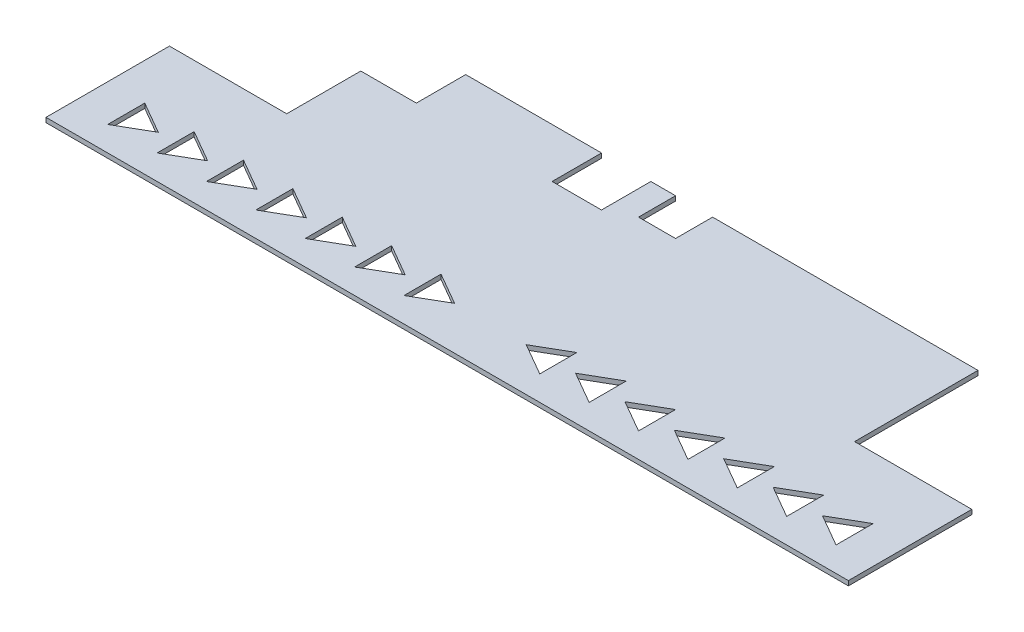
from build123d import *

# Parameters (mm, degrees)
SKETCH1_W          = 825.5
SKETCH1_H          = 254
BASE_FLANGE1_DEPTH = 4.7625
SKETCH6_W          = 38.1
SKETCH6_H          = 76.2
SKETCH6_W_2        = 241.3
SKETCH6_H_2        = 101.6
SKETCH6_W_3        = 50.8
CUT_EXTRUDE1_DEPTH = 432.872948801
SKETCH7_W          = 177.8
SKETCH7_H          = 50.8
SKETCH7_W_2        = 120.65
SKETCH7_H_2        = 25.4
CUT_EXTRUDE2_DEPTH = 432.872948801
CUT_EXTRUDE3_DEPTH = 432.872948801


# Sheet-metal steps are written as plain solids
with BuildPart() as part:
    # Sketch1 → Base-Flange1 (new body)
    with BuildSketch(Plane(origin=(0, 0, 0), x_dir=(1, 0, 0), z_dir=(0, 1, 0))):
        Rectangle(SKETCH1_W, SKETCH1_H)
    extrude(amount=-BASE_FLANGE1_DEPTH)

    # Sketch6 → Cut-Extrude1 (cut, through all)
    with BuildSketch(Plane(origin=(0, 0, 0), x_dir=(1, 0, 0), z_dir=(0, 1, 0))):
        with Locations((0, 127)):
            Rectangle(SKETCH6_W, SKETCH6_H)
        with Locations((-412.75, 50.8)):
            Rectangle(SKETCH6_W_2, SKETCH6_H_2)
        with Locations((412.75, 50.8)):
            Rectangle(SKETCH6_W_2, SKETCH6_H_2)
        with Locations((-69.85, 127)):
            Rectangle(SKETCH6_W_3, SKETCH6_H_2)
    extrude(amount=-CUT_EXTRUDE1_DEPTH, mode=Mode.SUBTRACT)

    # Sketch7 → Cut-Extrude2 (cut, through all)
    with BuildSketch(Plane(origin=(0, 0, 0), x_dir=(1, 0, 0), z_dir=(0, 1, 0))):
        with Locations((-323.85, 101.6)):
            Rectangle(SKETCH7_W, SKETCH7_H)
        with Locations((352.425, 114.3)):
            Rectangle(SKETCH7_W_2, SKETCH7_H_2)
    extrude(amount=-CUT_EXTRUDE2_DEPTH, mode=Mode.SUBTRACT)

    # Sketch8 → Cut-Extrude3 (cut, through all)
    with BuildSketch(Plane(origin=(0, 0, 0), x_dir=(1, 0, 0), z_dir=(0, 1, 0))):
        Polygon((341.654432116, -82.55), (374.65, -101.6), (374.65, -63.5), align=None)
        Polygon((323.85, -101.6), (323.85, -63.5), (290.854432116, -82.55), align=None)
        Polygon((273.05, -101.6), (273.05, -63.5), (240.054432116, -82.55), align=None)
        Polygon((222.25, -101.6), (222.25, -63.5), (189.254432116, -82.55), align=None)
        Polygon((171.45, -101.6), (171.45, -63.5), (138.454432116, -82.55), align=None)
        Polygon((120.65, -101.6), (120.65, -63.5), (87.654432116, -82.55), align=None)
        Polygon((69.85, -101.6), (69.85, -63.5), (36.854432116, -82.55), align=None)
        Polygon((-36.854432116, -82.55), (-69.85, -101.6), (-69.85, -63.5), align=None)
        Polygon((-87.654432116, -82.55), (-120.65, -101.6), (-120.65, -63.5), align=None)
        Polygon((-138.454432116, -82.55), (-171.45, -101.6), (-171.45, -63.5), align=None)
        Polygon((-189.254432116, -82.55), (-222.25, -101.6), (-222.25, -63.5), align=None)
        Polygon((-240.054432116, -82.55), (-273.05, -101.6), (-273.05, -63.5), align=None)
        Polygon((-290.854432116, -82.55), (-323.85, -101.6), (-323.85, -63.5), align=None)
        Polygon((-374.65, -63.5), (-341.654432116, -82.55), (-374.65, -101.6), align=None)
    extrude(amount=-CUT_EXTRUDE3_DEPTH, mode=Mode.SUBTRACT)


solid = part.part
